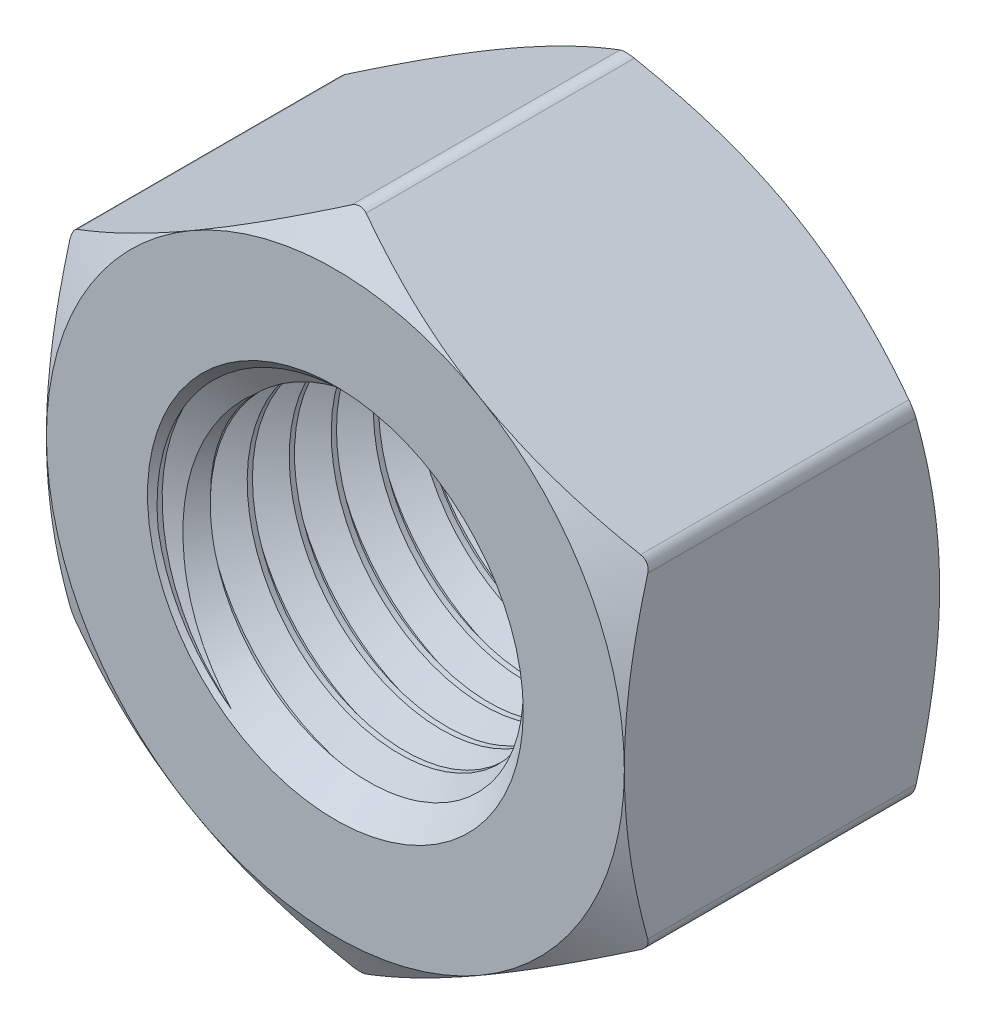
from build123d import *

# Parameters (mm, degrees)
BOSS_EXTRUDE2_DEPTH     = 4.7625
CUT_EXTRUDE4_DEPTH      = 15.16200674
CUT_EXTRUDE4_DEPTH_BACK = 15.16200674
SKETCH16_R              = 5.5499
SKETCH7_OUTSIDE_W       = 85.364
SKETCH7_OUTSIDE_H       = 88.066
SKETCH7_OUTSIDE_R       = 8.73125
CUT_EXTRUDE5_DEPTH      = 17.389223705
CUT_EXTRUDE5_DRAFT      = -60
MIRROR4_COPY_1_SKETCH_W = 85.364
MIRROR4_COPY_1_SKETCH_H = 88.066
MIRROR4_COPY_1_SKETCH_R = 8.73125
MIRROR4_COPY_1_DEPTH    = 17.389223705
MIRROR4_COPY_1_DRAFT    = -60
FILLET2_R               = 0.4365625
SKETCH13_R              = 5.5499
BOSS_EXTRUDE1_DEPTH     = 9.525
CUT_SWEEP1_PITCH        = 1.27
SKETCH17_R              = 5.5499
BOSS_EXTRUDE3_DEPTH     = 9.525


with BuildPart() as part:
    # Sketch15 → Boss-Extrude2 (new, symmetric)
    with BuildSketch(Plane.XY):
        Polygon((0, 10.081979076), (-8.73125, 5.040989538), (-8.73125, -5.040989538), (0, -10.081979076), (8.73125, -5.040989538), (8.73125, 5.040989538), align=None)
    extrude(amount=BOSS_EXTRUDE2_DEPTH, both=True)

    # Sketch16 → Cut-Extrude4 (cut, two sides: drawn at the far end of the back side and taken through both)
    with BuildSketch(Plane.XY.offset(-CUT_EXTRUDE4_DEPTH_BACK)):
        Circle(SKETCH16_R)
    extrude(amount=CUT_EXTRUDE4_DEPTH + CUT_EXTRUDE4_DEPTH_BACK, mode=Mode.SUBTRACT)


with BuildPart() as cut_extrude5_tool:
    # Sketch7 outside → Cut-Extrude5 (with draft: the straight prism first)
    with BuildSketch(Plane.XY.offset(4.7625)):
        Rectangle(SKETCH7_OUTSIDE_W, SKETCH7_OUTSIDE_H)
        Circle(SKETCH7_OUTSIDE_R, mode=Mode.SUBTRACT)
    extrude(amount=-CUT_EXTRUDE5_DEPTH)
    # Cut-Extrude5: the draft: its side faces are tilted about the plane it starts from
    cut_extrude5_sides = [cut_extrude5_tool.faces().sort_by_distance(p)[0] for p in [
        (0, -44.033, -3.932111852),
        (42.682, 0, -3.932111852),
        (0, 44.033, -3.932111852),
        (-42.682, 0, -3.932111852),
        (-8.73125, 0, -3.932111852),
    ]]
    draft(cut_extrude5_sides, Plane.XY.offset(4.7625), CUT_EXTRUDE5_DRAFT)


with BuildPart() as part_1:
    add(part.part)

    # Cut-Extrude5: cut by cut_extrude5_tool
    add(cut_extrude5_tool.part, mode=Mode.SUBTRACT)


with BuildPart() as mirror4_copy_1_tool:
    # Mirror4 copy 1 sketch → Mirror4 copy 1 (with draft: the straight prism first)
    with BuildSketch(Plane(origin=(0, 0, -4.7625), x_dir=(1, 0, 0), z_dir=(0, 0, -1))):
        Rectangle(MIRROR4_COPY_1_SKETCH_W, MIRROR4_COPY_1_SKETCH_H)
        Circle(MIRROR4_COPY_1_SKETCH_R, mode=Mode.SUBTRACT)
    extrude(amount=-MIRROR4_COPY_1_DEPTH)
    # Mirror4 copy 1: the draft: its side faces are tilted about the plane it starts from
    mirror4_copy_1_sides = [mirror4_copy_1_tool.faces().sort_by_distance(p)[0] for p in [
        (0, -44.033, 3.932111852),
        (42.682, 0, 3.932111852),
        (0, 44.033, 3.932111852),
        (-42.682, 0, 3.932111852),
        (-8.73125, 0, 3.932111852),
    ]]
    draft(mirror4_copy_1_sides, Plane(origin=(0, 0, -4.7625), x_dir=(1, 0, 0), z_dir=(0, 0, -1)), MIRROR4_COPY_1_DRAFT)


with BuildPart() as part_2:
    add(part_1.part)

    # Mirror4 copy 1: cut by mirror4_copy_1_tool
    add(mirror4_copy_1_tool.part, mode=Mode.SUBTRACT)

    # Fillet2
    fillet2_edges = [part_2.edges().sort_by_distance(p)[0] for p in [
        (-8.73125, 5.040989538, 0),
        (-8.73125, -5.040989538, 0),
        (0, -10.081979076, 0),
        (8.73125, -5.040989538, 0),
        (8.73125, 5.040989538, 0),
        (0, 10.081979076, 0),
    ]]
    fillet(fillet2_edges, radius=FILLET2_R)

    # Sketch17 → Boss-Extrude3 (add)
    with BuildSketch(Plane.XY.offset(4.7625)):
        Circle(SKETCH17_R)
    extrude(amount=-BOSS_EXTRUDE3_DEPTH)


with BuildPart() as body_2:
    # Sketch13 → Boss-Extrude1 (new body)
    with BuildSketch(Plane(origin=(0, 0, -4.7625), x_dir=(-1, 0, 0), z_dir=(0, 0, -1))):
        Circle(SKETCH13_R)
    extrude(amount=-BOSS_EXTRUDE1_DEPTH)

    # Cut-Sweep1: the profile of Sketch12 profile screwed along a right-hand helix of 8.5 turns, 8 arcs to a turn; built about Z, then put on its axis
    cut_sweep1_z = Axis((0, 0, 0), (0, 0, 1))
    cut_sweep1_corners = [(5.5502, 0, -1.111423205), (5.5502, 0, 0.000173205), (4.725010803, 0, -0.47625), (4.725010803, 0, -0.635)]
    with BuildLine(mode=Mode.PRIVATE) as cut_sweep1_profile:
        Line(cut_sweep1_corners[0], cut_sweep1_corners[1])
        Line(cut_sweep1_corners[1], cut_sweep1_corners[2])
        Line(cut_sweep1_corners[2], cut_sweep1_corners[3])
        Line(cut_sweep1_corners[3], cut_sweep1_corners[0])
    cut_sweep1_cap = Face(cut_sweep1_profile.wire())
    cut_sweep1_turn_angles = [0, 22.5, 45, 67.5, 90, 112.5, 135, 157.5, 180, 202.5, 225, 247.5, 270, 292.5, 315, 337.5, 360]
    cut_sweep1_turn_weights = [1, 0.9238795325112867, 1, 0.9238795325112867, 1, 0.9238795325112867, 1, 0.9238795325112867, 1, 0.9238795325112867, 1, 0.9238795325112867, 1, 0.9238795325112867, 1, 0.9238795325112867, 1]
    cut_sweep1_turn_rails = [Edge.make_bspline([Vector(p[0], p[1], 0).rotate(cut_sweep1_z, cut_sweep1_turn_angles[k]) / cut_sweep1_turn_weights[k] + Vector(0, 0, p[2] + CUT_SWEEP1_PITCH * cut_sweep1_turn_angles[k] / 360) for k in range(17)], [0, 0, 0, 1, 1, 2, 2, 3, 3, 4, 4, 5, 5, 6, 6, 7, 7, 8, 8, 8], 2, cut_sweep1_turn_weights) for p in cut_sweep1_corners]
    cut_sweep1_turn_sides = [Face.make_surface_from_curves(cut_sweep1_turn_rails[p[0]], cut_sweep1_turn_rails[p[1]]) for p in [(0, 1), (1, 2), (2, 3), (3, 0)]]
    cut_sweep1_last_angles = [2880, 2902.5, 2925, 2947.5, 2970, 2992.5, 3015, 3037.5, 3060]
    cut_sweep1_last_weights = [1, 0.9238795325112867, 1, 0.9238795325112867, 1, 0.9238795325112867, 1, 0.9238795325112837, 1]
    cut_sweep1_last_rails = [Edge.make_bspline([Vector(p[0], p[1], 0).rotate(cut_sweep1_z, cut_sweep1_last_angles[k]) / cut_sweep1_last_weights[k] + Vector(0, 0, p[2] + CUT_SWEEP1_PITCH * cut_sweep1_last_angles[k] / 360) for k in range(9)], [0, 0, 0, 1, 1, 2, 2, 3, 3, 4, 4, 4], 2, cut_sweep1_last_weights) for p in cut_sweep1_corners]
    cut_sweep1_last_sides = [Face.make_surface_from_curves(cut_sweep1_last_rails[p[0]], cut_sweep1_last_rails[p[1]]) for p in [(0, 1), (1, 2), (2, 3), (3, 0)]]
    cut_sweep1 = Plane(origin=(0, 0, -4.7625), x_dir=(0, 1, 0), z_dir=(0, 0, 1)) * Solid(Shell([*[p.moved(Location((0, 0, CUT_SWEEP1_PITCH * i))) for i in range(8) for p in cut_sweep1_turn_sides], *cut_sweep1_last_sides, cut_sweep1_cap, cut_sweep1_cap.rotate(cut_sweep1_z, 3060).moved(Location((0, 0, CUT_SWEEP1_PITCH * 3060 / 360)))]))
    add(cut_sweep1, mode=Mode.SUBTRACT)


with BuildPart() as part_3:
    add(part_2.part)

    # Combine1: cut body 2
    add(body_2.part, mode=Mode.SUBTRACT)

    # Cut-Extrude2 cone 1 section (through the dimple's axis) → Cut-Extrude2 (revolve, cut)
    with BuildSketch(Plane(origin=(0, 0, 4.7625), x_dir=(0, -1, 0), z_dir=(1, 0, 0))):
        Polygon((0, 0), (5.6769, 0), (0, 5.6769), align=None)
    revolve(axis=Axis((0, 0, 4.7625), (0, 0, -1)), mode=Mode.SUBTRACT)

    # Cut-Extrude3 cone 1 section (through the dimple's axis) → Cut-Extrude3 (revolve, cut)
    with BuildSketch(Plane(origin=(0, 0, -4.7625), x_dir=(0, 1, 0), z_dir=(1, 0, 0))):
        Polygon((0, 0), (5.6769, 0), (0, 5.6769), align=None)
    revolve(axis=Axis((0, 0, -4.7625), (0, 0, 1)), mode=Mode.SUBTRACT)


solid = part_3.part
